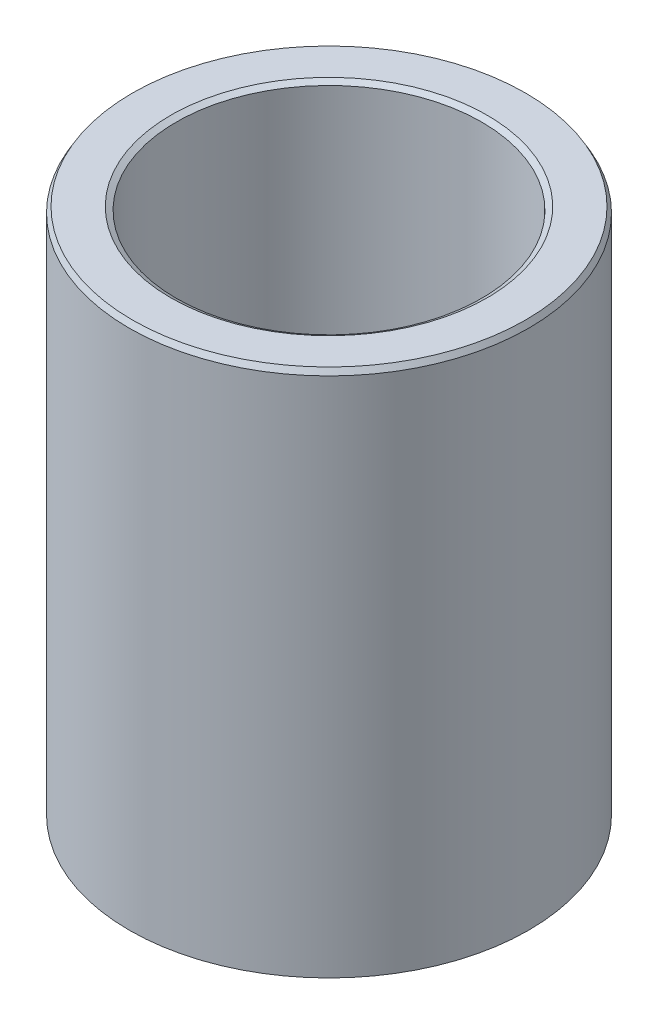
from build123d import *
from OCP.BRepFilletAPI import BRepFilletAPI_MakeChamfer

# Parameters (mm, degrees)
SKETCH1_R           = 17.5
BOSS_EXTRUDE1_DEPTH = 46.433616193
SKETCH2_R           = 13.379062462
CUT_EXTRUDE1_DEPTH  = 53.617304309
CHAMFER1_SIZE       = 0.480922512
CHAMFER1_SIZE2      = 0.277660742


with BuildPart() as part:
    # Sketch1 → Boss-Extrude1 (new body)
    with BuildSketch(Plane(origin=(0, 0, 0), x_dir=(1, 0, 0), z_dir=(0, 1, 0))):
        Circle(SKETCH1_R)
    extrude(amount=BOSS_EXTRUDE1_DEPTH)

    # Sketch2 → Cut-Extrude1 (cut, through all)
    with BuildSketch(Plane(origin=(0, 0, 0), x_dir=(1, 0, 0), z_dir=(0, 1, 0))):
        Circle(SKETCH2_R)
    extrude(amount=CUT_EXTRUDE1_DEPTH, mode=Mode.SUBTRACT)

    # Chamfer1: one chamfer whose edges measure the first distance from different faces: ONE call of the kernel's chamfer builder (chamfer() names one face for all edges)
    chamfer1_edges_1 = [part.edges().sort_by_distance(p)[0] for p in [
        (-13.379062462, 46.433616193, 0),
    ]]
    chamfer1_side_1 = [part.faces().sort_by_distance(p)[0] for p in [
        (-17.005025253, 46.433616193, 0),
    ]]
    chamfer1_edges_2 = [part.edges().sort_by_distance(p)[0] for p in [
        (-13.379062462, 0, 0),
    ]]
    chamfer1_side_2 = [part.faces().sort_by_distance(p)[0] for p in [
        (-13.379062462, 23.216808096, 0),
    ]]
    chamfer1_edges_3 = [part.edges().sort_by_distance(p)[0] for p in [
        (-17.5, 0, 0),
    ]]
    chamfer1_side_3 = [part.faces().sort_by_distance(p)[0] for p in [
        (-17.005025253, 0, 0),
    ]]
    chamfer1_edges_4 = [part.edges().sort_by_distance(p)[0] for p in [
        (-17.5, 46.433616193, 0),
    ]]
    chamfer1_side_4 = [part.faces().sort_by_distance(p)[0] for p in [
        (-17.5, 23.216808096, 0),
    ]]
    chamfer1 = BRepFilletAPI_MakeChamfer(part.part.solid().wrapped)
    for e in chamfer1_edges_1:
        chamfer1.Add(CHAMFER1_SIZE, CHAMFER1_SIZE2, e.wrapped, chamfer1_side_1[0].wrapped)  # the first distance lies on this face
    for e in chamfer1_edges_2:
        chamfer1.Add(CHAMFER1_SIZE, CHAMFER1_SIZE2, e.wrapped, chamfer1_side_2[0].wrapped)  # the first distance lies on this face
    for e in chamfer1_edges_3:
        chamfer1.Add(CHAMFER1_SIZE, CHAMFER1_SIZE2, e.wrapped, chamfer1_side_3[0].wrapped)  # the first distance lies on this face
    for e in chamfer1_edges_4:
        chamfer1.Add(CHAMFER1_SIZE, CHAMFER1_SIZE2, e.wrapped, chamfer1_side_4[0].wrapped)  # the first distance lies on this face
    add(Compound.cast(chamfer1.Shape()), mode=Mode.REPLACE)


solid = part.part
